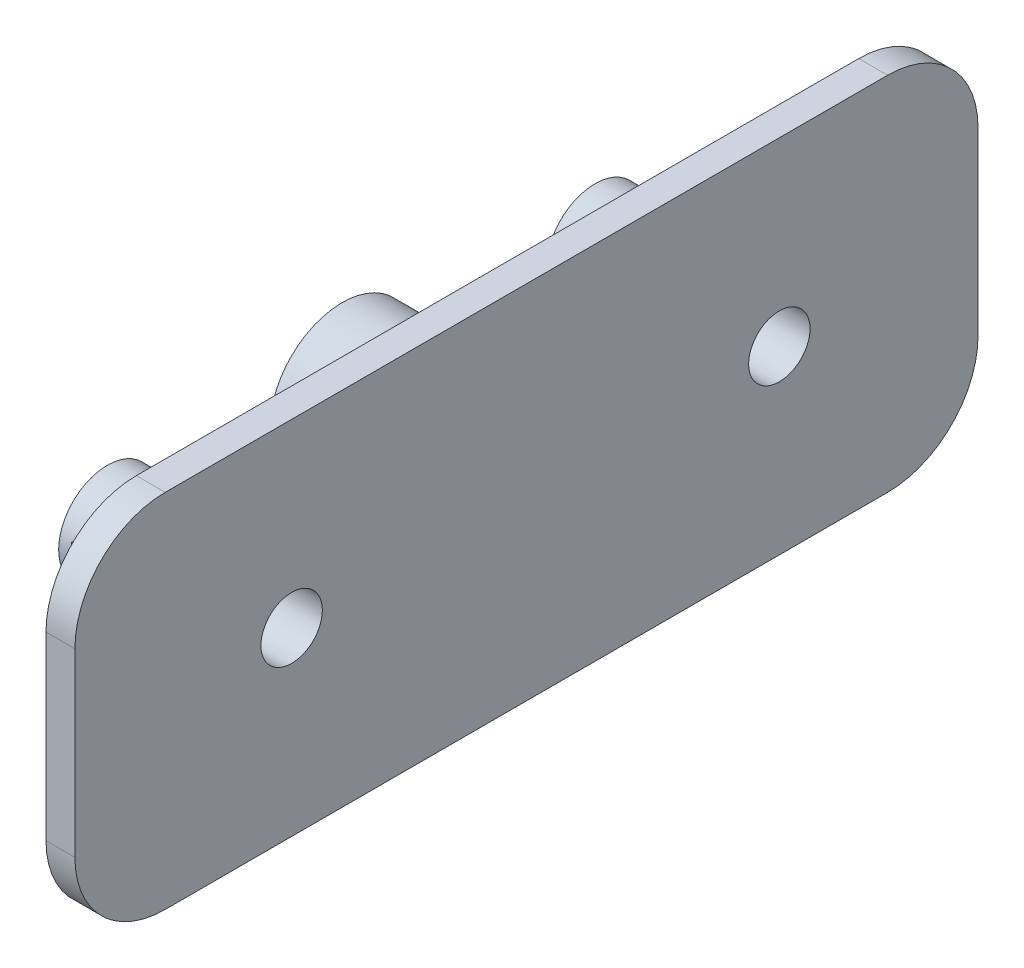
from build123d import *
from build123d.topology import SkipClean

# Parameters (mm, degrees)
SKETCH1_R                = 4
SKETCH1_R_2              = 3
BOSS_EXTRUDE1_DEPTH      = 5
SKETCH2_W                = 40
SKETCH2_H                = 10
SKETCH2_R                = 3
BOSS_EXTRUDE2_DEPTH      = 3.6
SKETCH7_W                = 50
SKETCH7_H                = 20
BOSS_EXTRUDE3_DEPTH      = 1.6
M3_CLEARANCE_HOLE1_D     = 3.4
M3_CLEARANCE_HOLE1_DEPTH = 12
M3_CLEARANCE_HOLE1_TIP   = 1.021463052
SKETCH8_R                = 2.7
SKETCH8_R_2              = 1.7
BOSS_EXTRUDE4_DEPTH      = 5
FILLET2_R                = 5


with BuildPart() as part:
    # Sketch1 → Boss-Extrude1 (new body)
    with BuildSketch(Plane(origin=(0, 0, 0), x_dir=(0, 0, -1), z_dir=(1, 0, 0))):
        Circle(SKETCH1_R)
        Circle(SKETCH1_R_2, mode=Mode.SUBTRACT)
    extrude(amount=BOSS_EXTRUDE1_DEPTH)

    # Sketch2 → Boss-Extrude2 (add)
    with BuildSketch(Plane(origin=(5, 0, 0), x_dir=(0, 0, -1), z_dir=(1, 0, 0))):
        Rectangle(SKETCH2_W, SKETCH2_H)
        Circle(SKETCH2_R, mode=Mode.SUBTRACT)
    extrude(amount=BOSS_EXTRUDE2_DEPTH)

    # Sketch7 → Boss-Extrude3 (add)
    with BuildSketch(Plane(origin=(8.6, 0, 0), x_dir=(0, 0, -1), z_dir=(1, 0, 0))):
        Rectangle(SKETCH7_W, SKETCH7_H)
    extrude(amount=BOSS_EXTRUDE3_DEPTH)

    # M3 Clearance Hole1
    with Locations(Plane.ZY.offset(-5)):
        with Locations((-14, 0), (13, 0)):
            Hole(M3_CLEARANCE_HOLE1_D / 2, depth=M3_CLEARANCE_HOLE1_DEPTH)
            with Locations((0, 0, -(M3_CLEARANCE_HOLE1_DEPTH + M3_CLEARANCE_HOLE1_TIP / 2))):  # 118° drill point
                Cone(0, M3_CLEARANCE_HOLE1_D / 2, M3_CLEARANCE_HOLE1_TIP, mode=Mode.SUBTRACT)

    # Sketch8 → Boss-Extrude4 (add)
    # profile 1 of 2: a face of its own
    with SkipClean():  # the faces are left unmerged after this step: merging them gives an invalid solid
        with BuildSketch(Plane.ZY.offset(-5)):
            with Locations((-14, 0)):
                Circle(SKETCH8_R)
            with Locations((-14, 0)):
                Circle(SKETCH8_R_2, mode=Mode.SUBTRACT)
        # profile 2 of 2: a face of its own
        with BuildSketch(Plane.ZY.offset(-5)):
            with Locations((13, 0)):
                Circle(SKETCH8_R)
            with Locations((13, 0)):
                Circle(SKETCH8_R_2, mode=Mode.SUBTRACT)
        extrude(amount=BOSS_EXTRUDE4_DEPTH)
    add(part.part.scale(1), mode=Mode.REPLACE)  # the faces are merged on a copy

    # Fillet2
    fillet2_edges = [part.edges().sort_by_distance(p)[0] for p in [
        (9.4, 10, -25),
        (9.4, -10, -25),
        (9.4, -10, 25),
        (9.4, 10, 25),
    ]]
    fillet(fillet2_edges, radius=FILLET2_R)


solid = part.part
